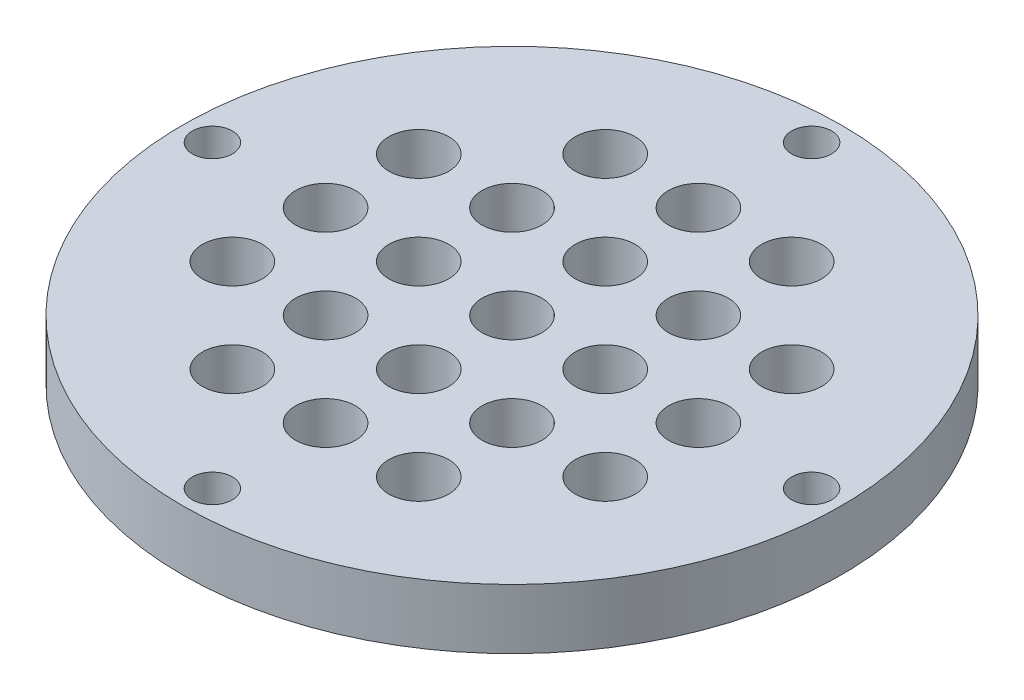
from build123d import *

# Parameters (mm, degrees)
SKETCH_1_R               = 16.5
EXTRUDE_1_DEPTH          = 3
SKETCH_2_R               = 1
CUT_EXTRUDE_1_DEPTH      = 1.5
SKETCH_2_3_R             = 0.6
CUT_EXTRUDE_2_DEPTH      = 24.526580712
PATTERN_CIRCULAR_1_COUNT = 4
OTHER_1_OUTLINE_R        = 1.5
OTHER_1_DEPTH            = 3


# Read off the part's stored shape, not the designer's step: 填充阵列1
with BuildPart() as part:
    # 草图1 → 凸台-拉伸1 (new body)
    with BuildSketch(Plane(origin=(0, 0, 0), x_dir=(1, 0, 0), z_dir=(0, 1, 0))):
        with Locations(Location((0, 0, 0), (0, 0, 270))):
            Circle(SKETCH_1_R)
    extrude(amount=EXTRUDE_1_DEPTH)

    # 草图2 → 切除-拉伸1 (cut)
    with BuildSketch(Plane(origin=(0, 3, 0), x_dir=(1, 0, 0), z_dir=(0, 1, 0))):
        with Locations(Location((15, 0, 0), (0, 0, 270))):
            Circle(SKETCH_2_R)
    cut_extrude_1 = extrude(amount=-CUT_EXTRUDE_1_DEPTH, mode=Mode.SUBTRACT)

    # 草图2<3> → 切除-拉伸2 (cut, through all)
    with BuildSketch(Plane(origin=(0, 3, 0), x_dir=(1, 0, 0), z_dir=(0, 1, 0))):
        with Locations(Location((15, 0, 0), (0, 0, 270))):
            Circle(SKETCH_2_3_R)
    cut_extrude_2 = extrude(amount=-CUT_EXTRUDE_2_DEPTH, mode=Mode.SUBTRACT)

    # 阵列(圆周)1: 切除-拉伸1, 切除-拉伸2 ×4 about axis
    pattern_circular_1_axis = Axis((0, 0, 0), (0, 1, 0))
    add([cut_extrude_1.rotate(pattern_circular_1_axis, i * 360 / PATTERN_CIRCULAR_1_COUNT) for i in range(1, PATTERN_CIRCULAR_1_COUNT)], mode=Mode.SUBTRACT)
    add([cut_extrude_2.rotate(pattern_circular_1_axis, i * 360 / PATTERN_CIRCULAR_1_COUNT) for i in range(1, PATTERN_CIRCULAR_1_COUNT)], mode=Mode.SUBTRACT)

    # 填充阵列1 outline → 填充阵列1 (cut)
    with BuildSketch(Plane(origin=(0, 0, 0), x_dir=(1, 0, 0), z_dir=(0, 1, 0))):
        with Locations((0, 3.371e-06)):
            Circle(OTHER_1_OUTLINE_R)
        with Locations((-4.666904756, -9.333806141)):
            Circle(OTHER_1_OUTLINE_R)
        with Locations((0, -9.333806141)):
            Circle(OTHER_1_OUTLINE_R)
        with Locations((4.666904756, -9.333806141)):
            Circle(OTHER_1_OUTLINE_R)
        with Locations((9.333809512, -4.666901385)):
            Circle(OTHER_1_OUTLINE_R)
        with Locations((-9.333809512, 3.371e-06)):
            Circle(OTHER_1_OUTLINE_R)
        with Locations((0, 4.666908127)):
            Circle(OTHER_1_OUTLINE_R)
        with Locations((-9.333809512, 4.666908127)):
            Circle(OTHER_1_OUTLINE_R)
        with Locations((4.666904756, 4.666908127)):
            Circle(OTHER_1_OUTLINE_R)
        with Locations((-4.666904756, -4.666901385)):
            Circle(OTHER_1_OUTLINE_R)
        with Locations((-4.666904756, 3.371e-06)):
            Circle(OTHER_1_OUTLINE_R)
        with Locations((-9.333809512, -4.666901385)):
            Circle(OTHER_1_OUTLINE_R)
        with Locations((-4.666904756, 4.666908127)):
            Circle(OTHER_1_OUTLINE_R)
        with Locations((9.333809512, 3.371e-06)):
            Circle(OTHER_1_OUTLINE_R)
        with Locations((9.333809512, 4.666908127)):
            Circle(OTHER_1_OUTLINE_R)
        with Locations((4.666904756, 9.333812883)):
            Circle(OTHER_1_OUTLINE_R)
        with Locations((0, -4.666901385)):
            Circle(OTHER_1_OUTLINE_R)
        with Locations((4.666904756, 3.371e-06)):
            Circle(OTHER_1_OUTLINE_R)
        with Locations((-4.666904756, 9.333812883)):
            Circle(OTHER_1_OUTLINE_R)
        with Locations((4.666904756, -4.666901385)):
            Circle(OTHER_1_OUTLINE_R)
        with Locations((0, 9.333812883)):
            Circle(OTHER_1_OUTLINE_R)
    extrude(amount=OTHER_1_DEPTH, mode=Mode.SUBTRACT)


solid = part.part
